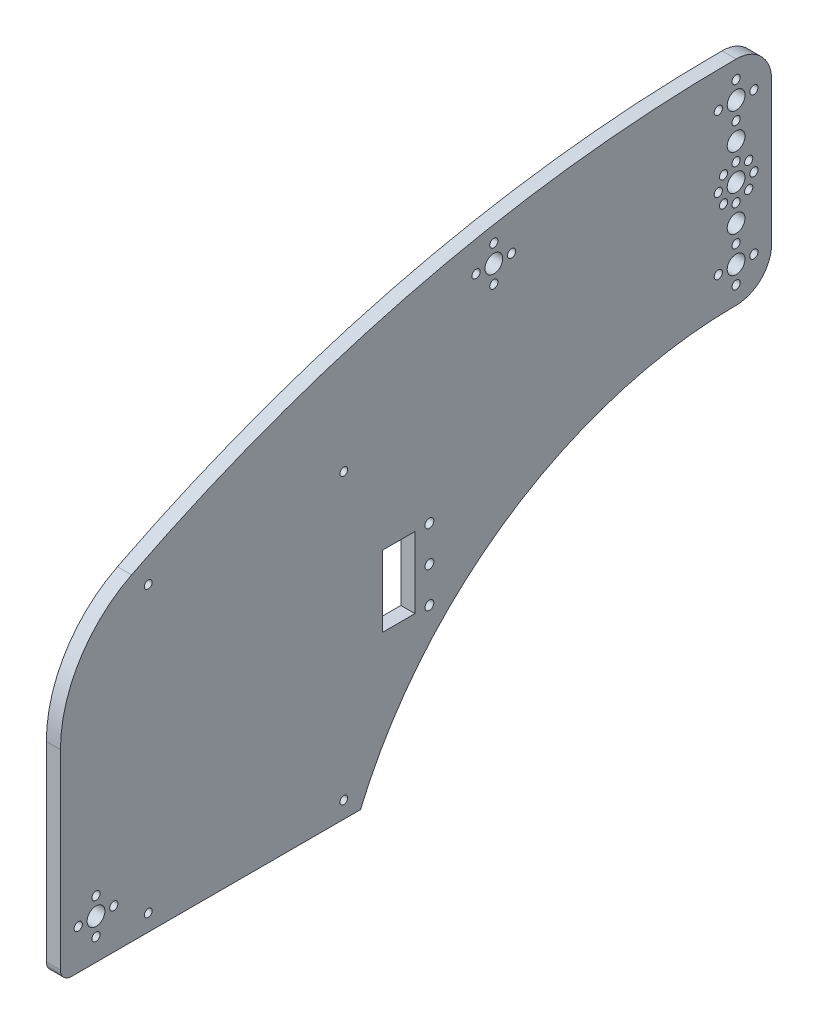
from build123d import *

# Parameters (mm, degrees)
SKETCH1_R           = 4
SKETCH1_R_2         = 1.85
SKETCH1_R_3         = 1.75
SKETCH1_R_4         = 2
SKETCH1_W           = 14.5
SKETCH1_H           = 32
BOSS_EXTRUDE2_DEPTH = 6.35


with BuildPart() as part:
    # Sketch1 → Boss-Extrude2 (new body)
    with BuildSketch(Plane(origin=(0, 0, 0), x_dir=(0, 0, -1), z_dir=(1, 0, 0))):
        with BuildLine():
            Line((-16, 72.903381643), (-16, -13))
            ThreePointArc((-16, -13), (-14.535533906, -16.535533906), (-11, -18))
            Line((-11, -18), (119, -18))
            ThreePointArc((119, -18), (186.628159729, 63.458401838), (288, 94))
            ThreePointArc((288, 94), (299.313708499, 98.686291501), (304, 110))
            Line((304, 110), (304, 174))
            ThreePointArc((304, 174), (299.313708499, 185.313708499), (288, 190))
            ThreePointArc((288, 190), (148.170639707, 173.524399996), (16, 125))
            ThreePointArc((16, 125), (-7.361120736, 103.473210086), (-16, 72.903381643))
        make_face()
        with Locations((288, 110)):
            Circle(SKETCH1_R, mode=Mode.SUBTRACT)
        with Locations((288, 118)):
            Circle(SKETCH1_R_2, mode=Mode.SUBTRACT)
        with Locations((288, 126)):
            Circle(SKETCH1_R, mode=Mode.SUBTRACT)
        with Locations((288, 134)):
            Circle(SKETCH1_R_2, mode=Mode.SUBTRACT)
        with Locations((288, 142)):
            Circle(SKETCH1_R, mode=Mode.SUBTRACT)
        with Locations((296, 110)):
            Circle(SKETCH1_R_2, mode=Mode.SUBTRACT)
        with Locations((288, 102)):
            Circle(SKETCH1_R_2, mode=Mode.SUBTRACT)
        with Locations((280, 110)):
            Circle(SKETCH1_R_2, mode=Mode.SUBTRACT)
        with Locations((282.343145751, 136.343145751)):
            Circle(SKETCH1_R_2, mode=Mode.SUBTRACT)
        with Locations((280, 142)):
            Circle(SKETCH1_R_2, mode=Mode.SUBTRACT)
        with Locations((282.343145751, 147.656854249)):
            Circle(SKETCH1_R_2, mode=Mode.SUBTRACT)
        with Locations((288, 150)):
            Circle(SKETCH1_R_2, mode=Mode.SUBTRACT)
        with Locations((293.656854249, 147.656854249)):
            Circle(SKETCH1_R_2, mode=Mode.SUBTRACT)
        with Locations((296, 142)):
            Circle(SKETCH1_R_2, mode=Mode.SUBTRACT)
        with Locations((293.656854249, 136.343145751)):
            Circle(SKETCH1_R_2, mode=Mode.SUBTRACT)
        with Locations((280, 174)):
            Circle(SKETCH1_R_2, mode=Mode.SUBTRACT)
        with Locations((288, 182)):
            Circle(SKETCH1_R_2, mode=Mode.SUBTRACT)
        with Locations((296, 174)):
            Circle(SKETCH1_R_2, mode=Mode.SUBTRACT)
        with Locations((288, 158)):
            Circle(SKETCH1_R, mode=Mode.SUBTRACT)
        with Locations((288, 166)):
            Circle(SKETCH1_R_2, mode=Mode.SUBTRACT)
        with Locations((288, 174)):
            Circle(SKETCH1_R, mode=Mode.SUBTRACT)
        Circle(SKETCH1_R, mode=Mode.SUBTRACT)
        with Locations((8, 0)):
            Circle(SKETCH1_R_2, mode=Mode.SUBTRACT)
        with Locations((0, -8)):
            Circle(SKETCH1_R_2, mode=Mode.SUBTRACT)
        with Locations((-8, 0)):
            Circle(SKETCH1_R_2, mode=Mode.SUBTRACT)
        with Locations((0, 8)):
            Circle(SKETCH1_R_2, mode=Mode.SUBTRACT)
        with Locations((23.5, 117.5)):
            Circle(SKETCH1_R_3, mode=Mode.SUBTRACT)
        with Locations((111.5, 117.5)):
            Circle(SKETCH1_R_3, mode=Mode.SUBTRACT)
        with Locations((111.5, -10.5)):
            Circle(SKETCH1_R_3, mode=Mode.SUBTRACT)
        with Locations((23.5, -10.5)):
            Circle(SKETCH1_R_3, mode=Mode.SUBTRACT)
        with Locations((150, 46.142053172)):
            Circle(SKETCH1_R_4, mode=Mode.SUBTRACT)
        with Locations((150, 62.142053172)):
            Circle(SKETCH1_R_4, mode=Mode.SUBTRACT)
        with Locations((150, 78.142053172)):
            Circle(SKETCH1_R_4, mode=Mode.SUBTRACT)
        with Locations((179, 164.784174979)):
            Circle(SKETCH1_R, mode=Mode.SUBTRACT)
        with Locations((187, 164.784174979)):
            Circle(SKETCH1_R_2, mode=Mode.SUBTRACT)
        with Locations((179, 156.784174979)):
            Circle(SKETCH1_R_2, mode=Mode.SUBTRACT)
        with Locations((171, 164.784174979)):
            Circle(SKETCH1_R_2, mode=Mode.SUBTRACT)
        with Locations((179, 172.784174979)):
            Circle(SKETCH1_R_2, mode=Mode.SUBTRACT)
        with Locations((136.25, 62.142053172)):
            Rectangle(SKETCH1_W, SKETCH1_H, mode=Mode.SUBTRACT)
    extrude(amount=BOSS_EXTRUDE2_DEPTH)


solid = part.part
